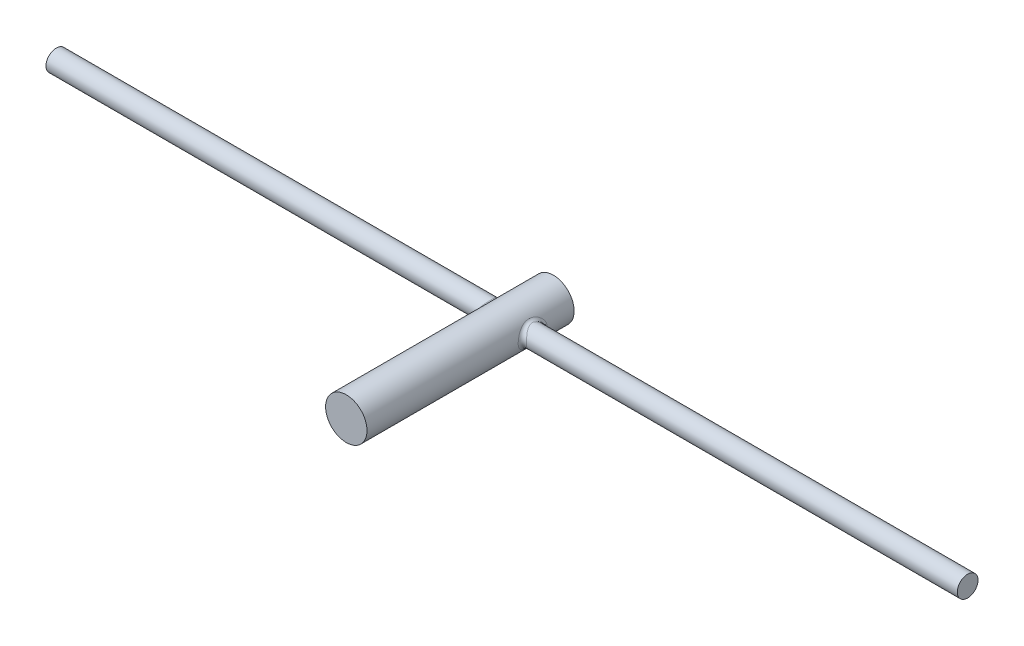
from build123d import *

# Parameters (mm, degrees)
SKETCH1_R                = 5
BOSS_EXTRUDE1_DEPTH      = 50
BOSS_EXTRUDE2_DEPTH      = 110
BOSS_EXTRUDE2_DEPTH_BACK = 110
SKETCH2_R                = 2.5
FILLET1_R                = 1


with BuildPart() as part:
    # Sketch1 → Boss-Extrude1 (new body)
    with BuildSketch(Plane.XY):
        Circle(SKETCH1_R)
    extrude(amount=BOSS_EXTRUDE1_DEPTH)

    # Sketch2 → Boss-Extrude2 (add, two sides: drawn at the far end of the back side and taken through both)
    with BuildSketch(Plane(origin=(0, 0, 0), x_dir=(0, 0, -1), z_dir=(1, 0, 0)).offset(-BOSS_EXTRUDE2_DEPTH_BACK)):
        with Locations((-10, 0)):
            Circle(SKETCH2_R)
    extrude(amount=BOSS_EXTRUDE2_DEPTH + BOSS_EXTRUDE2_DEPTH_BACK)

    # Fillet1
    fillet1_edges = [part.edges().sort_by_distance(p)[0] for p in [
        (-4.999960513, -0.019871133, 12.499921026),
        (4.330127047, 2.499999952, 10.000491239),
    ]]
    fillet(fillet1_edges, radius=FILLET1_R - 0.0001)  # a hair under: the kernel refuses the full size


solid = part.part
